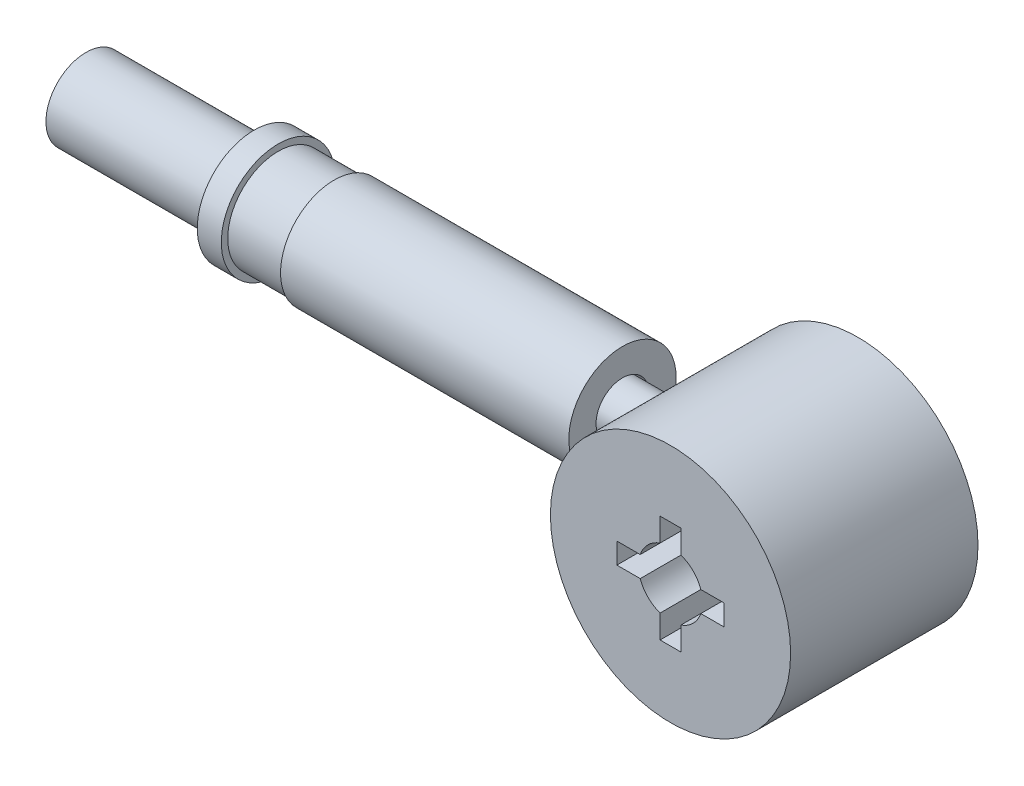
from build123d import *

# Parameters (mm, degrees)
SKETCH_2_R          = 3.35
SKETCH_2_R_2        = 1.65
EXTRUDE_1_DEPTH     = 18
EXTRUDE_START       = 8
SKETCH_3_R          = 7.5
EXTRUDE_2_DEPTH     = 11.7
SKETCH_4_R          = 2
CUT_EXTRUDE_1_DEPTH = 5
CUT_EXTRUDE_2_DEPTH = 5


with BuildPart() as part:
    # Эскиз1 → Повернуть1 (revolve)
    with BuildSketch(Plane.XY):
        Polygon((0, 0), (0, 2.5), (10.5, 2.5), (10.5, 3.55), (12, 3.55), (12, 3.15), (15.5, 3.15), (15.5, 1.55), (41, 1.55), (41, 0), align=None)
    revolve(axis=Axis((0, 0, 0), (-1, 0, 0)))

    # Эскиз2 → Бобышка-Вытянуть1 (add)
    with BuildSketch(Plane(origin=(15.5, 0, 0), x_dir=(0, 0, -1), z_dir=(1, 0, 0))):
        Circle(SKETCH_2_R)
        Circle(SKETCH_2_R_2, mode=Mode.SUBTRACT)
    extrude(amount=EXTRUDE_1_DEPTH)

    # Эскиз3 → Бобышка-Вытянуть2 (add)
    with BuildSketch(Plane.XY.offset(EXTRUDE_START)):
        with Locations((44.5, 0)):
            Circle(SKETCH_3_R)
    extrude(amount=-EXTRUDE_2_DEPTH)

    # Эскиз4 → Вырез-Вытянуть1 (cut)
    with BuildSketch(Plane.XY.offset(8)):
        with Locations((44.5, 0)):
            Circle(SKETCH_4_R)
    extrude(amount=-CUT_EXTRUDE_1_DEPTH, mode=Mode.SUBTRACT)

    # Эскиз5 → Вырез-Вытянуть2 (cut)
    with BuildSketch(Plane.XY.offset(8)):
        Polygon((43.85, 0.65), (43.85, 3.35), (45.15, 3.35), (45.15, 0.65), (47.85, 0.65), (47.85, -0.65), (45.15, -0.65), (45.15, -3.35), (43.85, -3.35), (43.85, -0.65), (41.15, -0.65), (41.15, 0.65), align=None)
    extrude(amount=-CUT_EXTRUDE_2_DEPTH, mode=Mode.SUBTRACT)


solid = part.part
